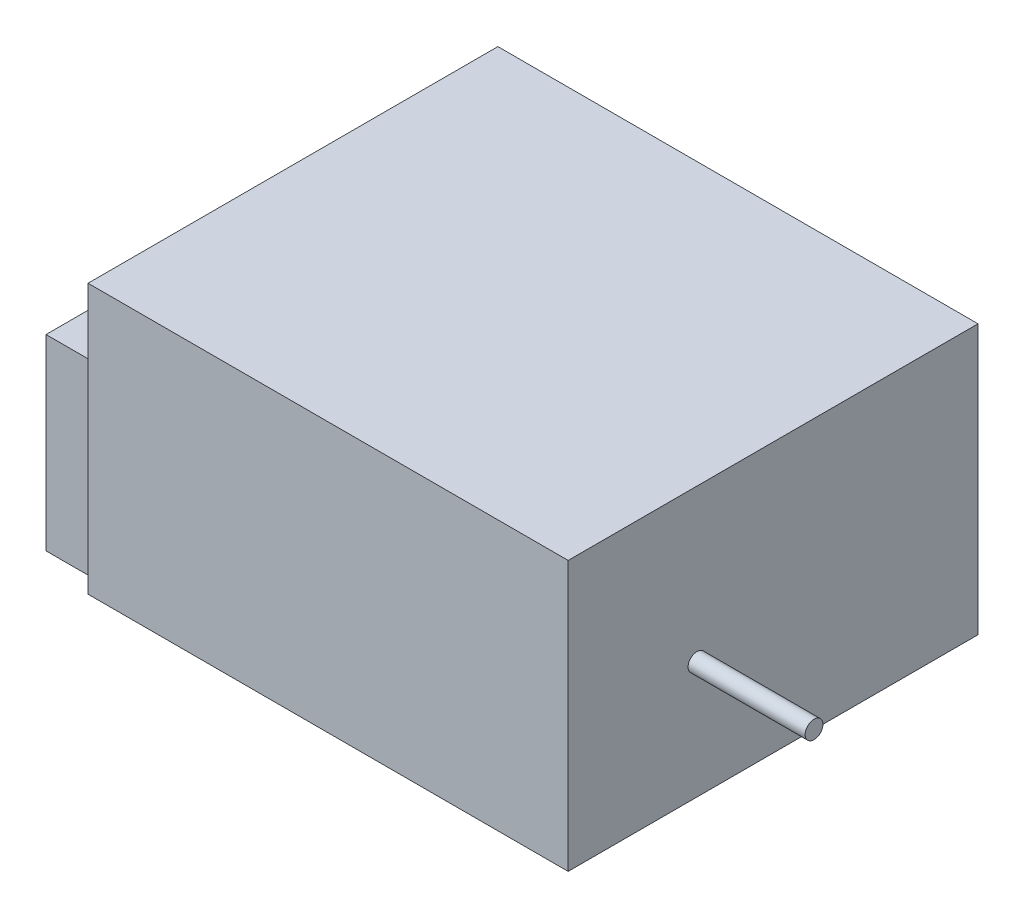
from build123d import *

# Parameters (mm, degrees)
SKETCH1_W           = 104.14
SKETCH1_H           = 88.9
BOSS_EXTRUDE1_DEPTH = 58.42
SKETCH2_W           = 40.64
SKETCH2_H           = 40.64
BOSS_EXTRUDE2_DEPTH = 12.7
SKETCH3_R           = 1.927464999
BOSS_EXTRUDE3_DEPTH = 25.4
SKETCH4_R           = 2.682066204
BOSS_EXTRUDE4_DEPTH = 25.4


with BuildPart() as part:
    # Sketch1 → Boss-Extrude1 (new body)
    with BuildSketch(Plane(origin=(0, 0, 0), x_dir=(1, 0, 0), z_dir=(0, 1, 0))):
        Rectangle(SKETCH1_W, SKETCH1_H)
    extrude(amount=BOSS_EXTRUDE1_DEPTH)

    # Sketch2 → Boss-Extrude2 (add)
    with BuildSketch(Plane.ZY.offset(52.07)):
        with Locations((20.544561746, 20.32)):
            Rectangle(SKETCH2_W, SKETCH2_H)
    extrude(amount=BOSS_EXTRUDE2_DEPTH)

    # Sketch3 → Boss-Extrude3 (add)
    with BuildSketch(Plane(origin=(52.07, 0, 0), x_dir=(0, 0, -1), z_dir=(1, 0, 0))):
        with Locations((-16.51, 25.4)):
            Circle(SKETCH3_R)
    extrude(amount=BOSS_EXTRUDE3_DEPTH)

    # Sketch4 → Boss-Extrude4 (add)
    with BuildSketch(Plane.ZY.offset(52.07)):
        with Locations((-39.37, 25.4)):
            Circle(SKETCH4_R)
    extrude(amount=BOSS_EXTRUDE4_DEPTH)


solid = part.part
